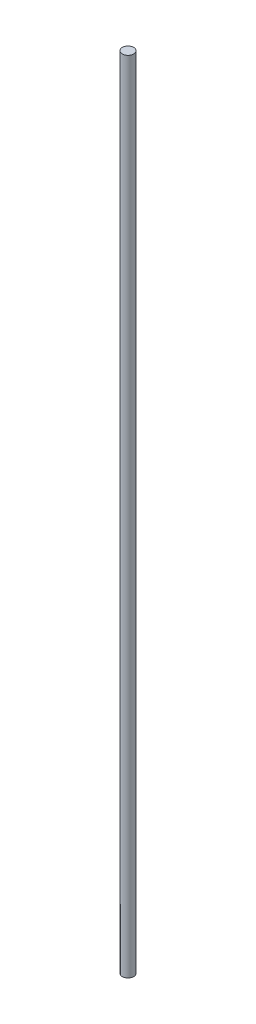
from build123d import *

# Parameters (mm, degrees)
SKETCH_1_R      = 2.5
EXTRUDE_1_DEPTH = 350


with BuildPart() as part:
    # 草圖1 → 填料-伸長1 (new body)
    with BuildSketch(Plane(origin=(0, 0, 0), x_dir=(1, 0, 0), z_dir=(0, 1, 0))):
        Circle(SKETCH_1_R)
    extrude(amount=EXTRUDE_1_DEPTH)


solid = part.part
